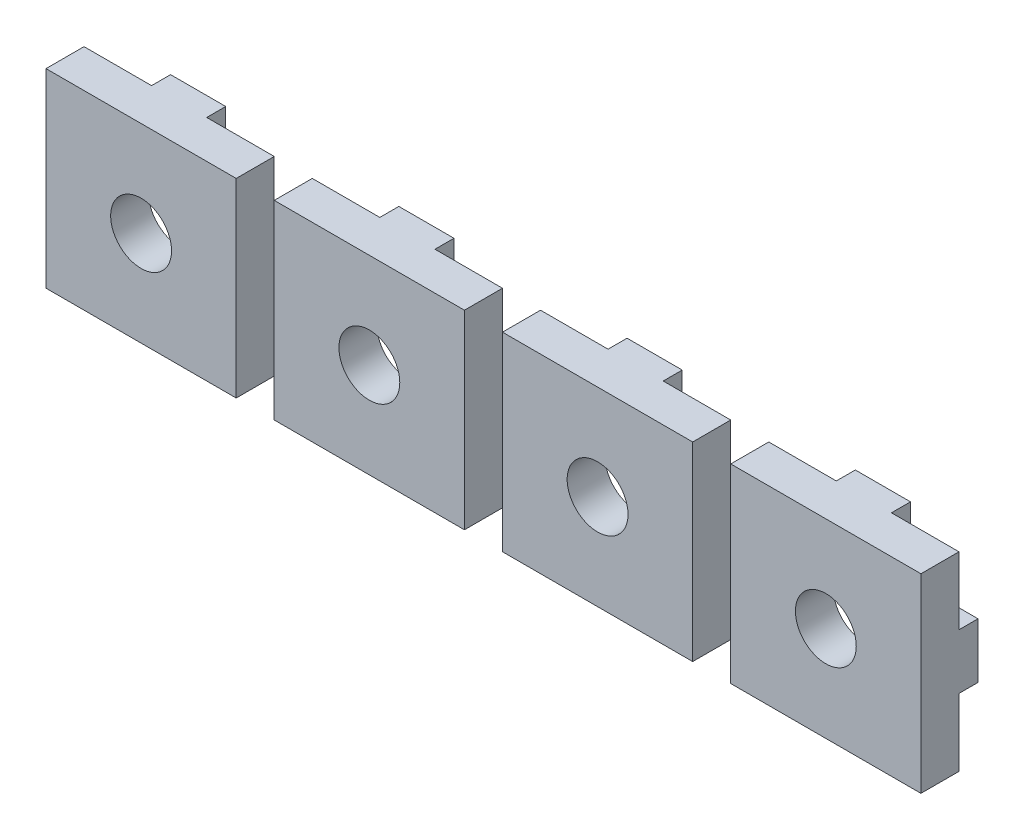
from build123d import *

# Parameters (mm, degrees)
SKETCH1_W                = 10
SKETCH1_H                = 10
SKETCH1_R                = 1.6
MAIN_DEPTH               = 2
SKETCH2_W                = 1
SKETCH2_H                = 2.9
ANTIROTATIONSYSTEM_DEPTH = 1
CIRPATTERN1_COUNT        = 4
LPATTERN1_COUNT          = 4
LPATTERN1_PITCH          = 12


with BuildPart() as part:
    # Sketch1 → Main (new body)
    with BuildSketch(Plane.XY):
        Rectangle(SKETCH1_W, SKETCH1_H)
        Circle(SKETCH1_R, mode=Mode.SUBTRACT)
    extrude(amount=MAIN_DEPTH)

    # Sketch2 → AntiRotationSystem (add)
    with BuildSketch(Plane(origin=(0, 0, 0), x_dir=(-1, 0, 0), z_dir=(0, 0, -1))):
        with Locations((-4.5, 0)):
            Rectangle(SKETCH2_W, SKETCH2_H)
    antirotationsystem = extrude(amount=ANTIROTATIONSYSTEM_DEPTH)

    # CirPattern1: AntiRotationSystem ×4 about axis
    cirpattern1_axis = Axis((0, 0, -1.2), (0, 0, 1))
    for i in range(1, CIRPATTERN1_COUNT):
        add(antirotationsystem.rotate(cirpattern1_axis, i * 360 / CIRPATTERN1_COUNT))


with BuildPart() as lpattern1_1:
    # LPattern1: pattern copy
    add(part.part.moved(Location(Vector(1, 0, 0) * (1 * LPATTERN1_PITCH))))


with BuildPart() as lpattern1_2:
    # LPattern1: pattern copy
    add(part.part.moved(Location(Vector(1, 0, 0) * (2 * LPATTERN1_PITCH))))


with BuildPart() as lpattern1_3:
    # LPattern1: pattern copy
    add(part.part.moved(Location(Vector(1, 0, 0) * (3 * LPATTERN1_PITCH))))


solid = Compound([part.part, lpattern1_1.part, lpattern1_2.part, lpattern1_3.part])
